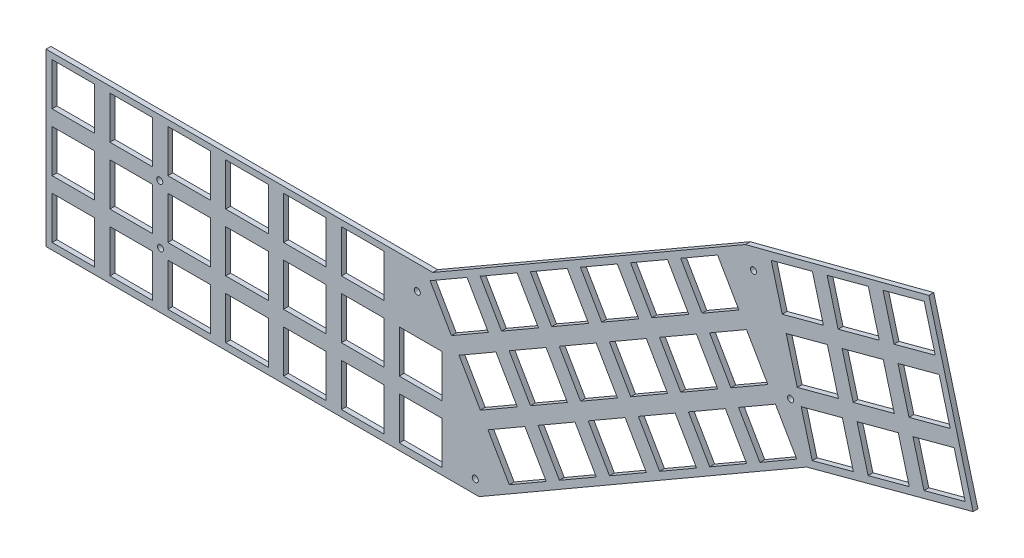
from build123d import *

# Parameters (mm, degrees)
MODEL_R            = 1
MODEL_W            = 14
MODEL_H            = 14
BOSS_EXTRU_1_DEPTH = 1.6


with BuildPart() as part:
    # Model → Boss.-Extru.1 (new body)
    with BuildSketch(Plane.XY):
        Polygon((152.811395456, 25.971686302), (138.282595456, 80.221514302), (78.010935456, 64.541586302), (-24.588554544, 5.301674302), (-151.608757489, 5.292943326), (-151.608757489, -50.858487698), (-9.398592544, -50.858487698), (98.150595456, 11.331634302), align=None)
        with Locations((80.685555456, 58.489274302)):
            Circle(MODEL_R, mode=Mode.SUBTRACT)
        with Locations((92.877555456, 28.085474302)):
            Circle(MODEL_R, mode=Mode.SUBTRACT)
        with Locations((-29.702844544, -2.648525698)):
            Circle(MODEL_R, mode=Mode.SUBTRACT)
        with Locations((-10.652844544, -46.438125698)):
            Circle(MODEL_R, mode=Mode.SUBTRACT)
        with Locations((-114.259444544, -13.418125698)):
            Circle(MODEL_R, mode=Mode.SUBTRACT)
        with Locations((-114.030844544, -32.493525698)):
            Circle(MODEL_R, mode=Mode.SUBTRACT)
        with Locations((-47.608757489, -41.687645053)):
            Rectangle(MODEL_W, MODEL_H, mode=Mode.SUBTRACT)
        with Locations((-28.608757489, -41.687645053)):
            Rectangle(MODEL_W, MODEL_H, mode=Mode.SUBTRACT)
        with Locations((-28.608757489, -22.687645053)):
            Rectangle(MODEL_W, MODEL_H, mode=Mode.SUBTRACT)
        with Locations((-47.608757489, -22.687645053)):
            Rectangle(MODEL_W, MODEL_H, mode=Mode.SUBTRACT)
        with Locations((-47.608757489, -3.687645053)):
            Rectangle(MODEL_W, MODEL_H, mode=Mode.SUBTRACT)
        with Locations((-66.608757489, -41.687645053)):
            Rectangle(MODEL_W, MODEL_H, mode=Mode.SUBTRACT)
        with Locations((-66.608757489, -22.687645053)):
            Rectangle(MODEL_W, MODEL_H, mode=Mode.SUBTRACT)
        with Locations((-66.608757489, -3.687645053)):
            Rectangle(MODEL_W, MODEL_H, mode=Mode.SUBTRACT)
        with Locations((-85.608757489, -41.687645053)):
            Rectangle(MODEL_W, MODEL_H, mode=Mode.SUBTRACT)
        with Locations((-85.608757489, -22.687645053)):
            Rectangle(MODEL_W, MODEL_H, mode=Mode.SUBTRACT)
        with Locations((-85.608757489, -3.687645053)):
            Rectangle(MODEL_W, MODEL_H, mode=Mode.SUBTRACT)
        with Locations((-104.608757489, -41.687645053)):
            Rectangle(MODEL_W, MODEL_H, mode=Mode.SUBTRACT)
        with Locations((-104.608757489, -22.687645053)):
            Rectangle(MODEL_W, MODEL_H, mode=Mode.SUBTRACT)
        with Locations((-123.608757489, -41.687645053)):
            Rectangle(MODEL_W, MODEL_H, mode=Mode.SUBTRACT)
        with Locations((-123.608757489, -22.687645053)):
            Rectangle(MODEL_W, MODEL_H, mode=Mode.SUBTRACT)
        with Locations((-142.608757489, -41.687645053)):
            Rectangle(MODEL_W, MODEL_H, mode=Mode.SUBTRACT)
        with Locations((-142.608757489, -22.687645053)):
            Rectangle(MODEL_W, MODEL_H, mode=Mode.SUBTRACT)
        with Locations((-104.608757489, -3.687645053)):
            Rectangle(MODEL_W, MODEL_H, mode=Mode.SUBTRACT)
        with Locations((-123.608757489, -3.687645053)):
            Rectangle(MODEL_W, MODEL_H, mode=Mode.SUBTRACT)
        with Locations((-142.608757489, -3.687645053)):
            Rectangle(MODEL_W, MODEL_H, mode=Mode.SUBTRACT)
        Polygon((96.348705043, 27.596940797), (99.972171674, 14.073979229), (113.495133242, 17.69744586), (109.871666611, 31.220407428), align=None, mode=Mode.SUBTRACT)
        Polygon((91.431143186, 45.949531496), (95.054609817, 32.426569928), (108.577571385, 36.05003656), (104.954104754, 49.572998128), align=None, mode=Mode.SUBTRACT)
        Polygon((109.783733885, 50.867093353), (113.407200517, 37.344131785), (126.930162085, 40.967598417), (123.306695453, 54.490559985), align=None, mode=Mode.SUBTRACT)
        Polygon((114.701295742, 32.514502654), (118.324762374, 18.991541086), (131.847723942, 22.615007717), (128.22425731, 36.137969285), align=None, mode=Mode.SUBTRACT)
        Polygon((133.053886442, 37.432064511), (136.677353073, 23.909102943), (150.200314641, 27.532569574), (146.57684801, 41.055531142), align=None, mode=Mode.SUBTRACT)
        Polygon((128.136324585, 55.78465521), (131.759791216, 42.261693642), (145.282752784, 45.885160273), (141.659286153, 59.408121842), align=None, mode=Mode.SUBTRACT)
        Polygon((123.218762728, 74.13724591), (126.842229359, 60.614284342), (140.365190927, 64.237750973), (136.741724296, 77.760712541), align=None, mode=Mode.SUBTRACT)
        Polygon((104.866172028, 69.219684053), (108.48963866, 55.696722485), (122.012600228, 59.320189116), (118.389133596, 72.843150684), align=None, mode=Mode.SUBTRACT)
        Polygon((86.513581329, 64.302122196), (90.13704796, 50.779160628), (103.660009528, 54.402627259), (100.036542897, 67.925588827), align=None, mode=Mode.SUBTRACT)
        Polygon((87.902027772, 24.098212514), (94.902027772, 11.973856861), (82.777672119, 4.973856861), (75.777672119, 17.098212514), align=None, mode=Mode.SUBTRACT)
        Polygon((78.402027772, 40.552695186), (85.402027772, 28.428339533), (73.277672119, 21.428339533), (66.277672119, 33.552695186), align=None, mode=Mode.SUBTRACT)
        Polygon((68.902027772, 57.007177858), (75.902027772, 44.882822205), (63.777672119, 37.882822205), (56.777672119, 50.007177858), align=None, mode=Mode.SUBTRACT)
        Polygon((71.4475451, 14.598212514), (78.4475451, 2.473856861), (66.323189447, -4.526143139), (59.323189447, 7.598212514), align=None, mode=Mode.SUBTRACT)
        Polygon((61.9475451, 31.052695186), (68.9475451, 18.928339533), (56.823189447, 11.928339533), (49.823189447, 24.052695186), align=None, mode=Mode.SUBTRACT)
        Polygon((52.4475451, 47.507177858), (59.4475451, 35.382822205), (47.323189447, 28.382822205), (40.323189447, 40.507177858), align=None, mode=Mode.SUBTRACT)
        Polygon((54.993062428, 5.098212514), (61.993062428, -7.026143139), (49.868706775, -14.026143139), (42.868706775, -1.901787486), align=None, mode=Mode.SUBTRACT)
        Polygon((45.493062428, 21.552695186), (52.493062428, 9.428339533), (40.368706775, 2.428339533), (33.368706775, 14.552695186), align=None, mode=Mode.SUBTRACT)
        Polygon((38.538579756, -4.401787486), (45.538579756, -16.526143139), (33.414224103, -23.526143139), (26.414224103, -11.401787486), align=None, mode=Mode.SUBTRACT)
        Polygon((29.038579756, 12.052695186), (36.038579756, -0.071660467), (23.914224103, -7.071660467), (16.914224103, 5.052695186), align=None, mode=Mode.SUBTRACT)
        Polygon((35.993062428, 38.007177858), (42.993062428, 25.882822205), (30.868706775, 18.882822205), (23.868706775, 31.007177858), align=None, mode=Mode.SUBTRACT)
        Polygon((19.538579756, 28.507177858), (26.538579756, 16.382822205), (14.414224103, 9.382822205), (7.414224103, 21.507177858), align=None, mode=Mode.SUBTRACT)
        Polygon((3.084097084, 19.007177858), (10.084097084, 6.882822205), (-2.040258569, -0.117177795), (-9.040258569, 12.007177858), align=None, mode=Mode.SUBTRACT)
        Polygon((12.584097084, 2.552695186), (19.584097084, -9.571660467), (7.459741431, -16.571660467), (0.459741431, -4.447304814), align=None, mode=Mode.SUBTRACT)
        Polygon((22.084097084, -13.901787486), (29.084097084, -26.026143139), (16.959741431, -33.026143139), (9.959741431, -20.901787486), align=None, mode=Mode.SUBTRACT)
        Polygon((5.629614412, -23.401787486), (12.629614412, -35.526143139), (0.505258759, -42.526143139), (-6.494741241, -30.401787486), align=None, mode=Mode.SUBTRACT)
        Polygon((-3.870385588, -6.947304814), (3.129614412, -19.071660467), (-8.994741241, -26.071660467), (-15.994741241, -13.947304814), align=None, mode=Mode.SUBTRACT)
        Polygon((-13.370385588, 9.507177858), (-25.494741241, 2.507177858), (-18.494741241, -9.617177795), (-6.370385588, -2.617177795), align=None, mode=Mode.SUBTRACT)
    extrude(amount=BOSS_EXTRU_1_DEPTH)


solid = part.part
